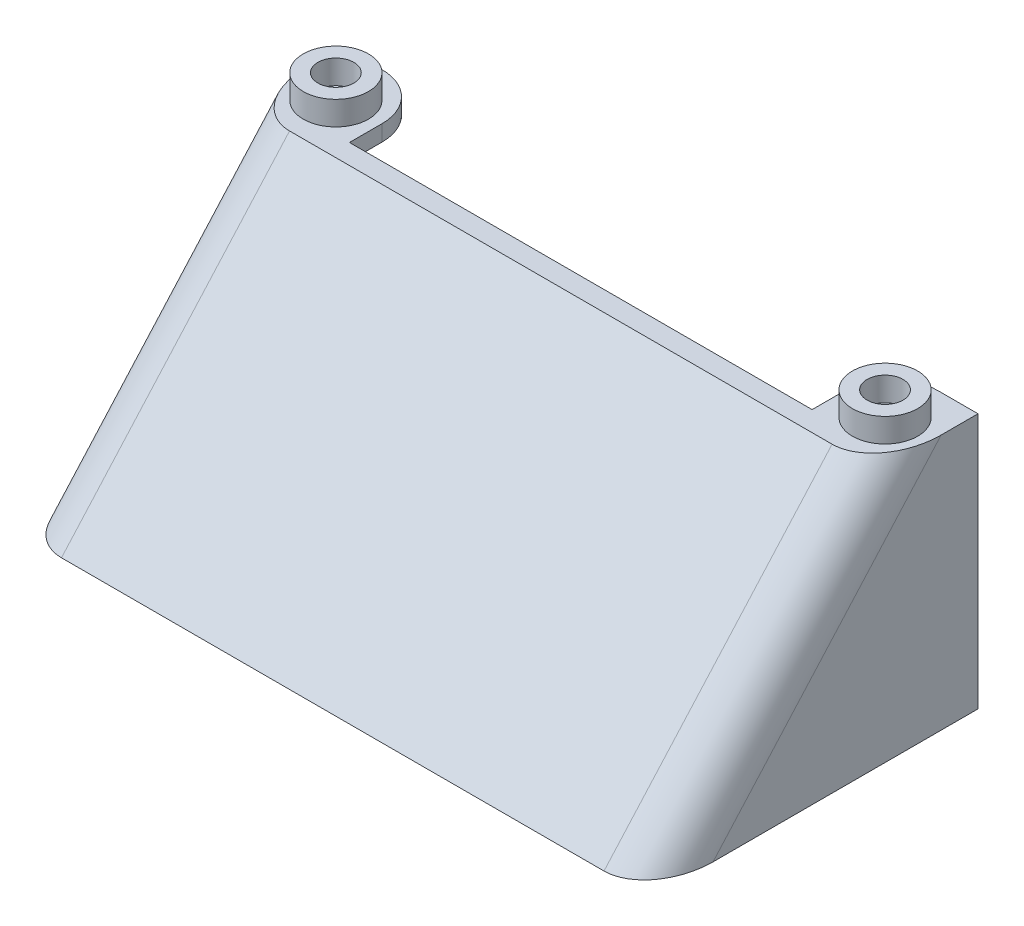
from build123d import *

# Parameters (mm, degrees)
BOSS_EXTRUDE1_DEPTH     = 47.75
SHELL2_T                = -1.2
SKETCH2_W               = 45.35
SKETCH2_H               = 17.927015757
CUT_EXTRUDE1_DEPTH      = 57.531559043
CUT_EXTRUDE2_DEPTH      = 58.038533691
CUT_EXTRUDE2_DEPTH_BACK = 58.038533691
BOSS_EXTRUDE2_DEPTH     = 3.5
CUT_EXTRUDE3_DEPTH      = 58.038533691
SKETCH7_R               = 2.45
SKETCH7_R_2             = 1.35
BOSS_EXTRUDE3_DEPTH     = 1.8
SHELL3_START            = -46.25
SHELL3_DEPTH            = 44.75
SHELL3_2_OUTLINE_W      = 2
SHELL3_2_OUTLINE_H      = 16.790482419
SHELL3_2_DEPTH          = 4.8
SHELL3_START_2          = -6.3
SHELL3_3_OUTLINE_W      = 2
SHELL3_3_OUTLINE_H      = 16.790482419
SHELL3_3_DEPTH          = 4.8
SKETCH8_R               = 1.5
SKETCH8_R_2             = 0.7
BOSS_EXTRUDE4_DEPTH     = 1.8
FILLET1_R               = 3.5


# Read off the part's stored shape, not the designer's step: Shell3
with BuildPart() as part:
    # Sketch1 → Boss-Extrude1 (new body)
    with BuildSketch(Plane(origin=(0, 0, 0), x_dir=(0, 0, -1), z_dir=(1, 0, 0))):
        Polygon((0, 0), (0, 19.2), (-7.46, 19.2), (-24.590482419, 0), align=None)
    extrude(amount=-BOSS_EXTRUDE1_DEPTH)

    # Shell2
    shell2_openings = [part.faces().sort_by_distance(p)[0] for p in [
        (-23.875, 0, 12.29524121),
    ]]
    offset(amount=SHELL2_T, openings=shell2_openings, kind=Kind.INTERSECTION)

    # Sketch2 → Cut-Extrude1 (cut, through all)
    with BuildSketch(Plane.XY.offset(1.2)):
        with Locations((-23.875, 8.963507878)):
            Rectangle(SKETCH2_W, SKETCH2_H)
    extrude(amount=-CUT_EXTRUDE1_DEPTH, mode=Mode.SUBTRACT)

    # Sketch3 → Cut-Extrude2 (cut, two sides: drawn at the far end of the back side and taken through both)
    with BuildSketch(Plane(origin=(0, 19.2, 0), x_dir=(1, 0, 0), z_dir=(0, 1, 0)).offset(-CUT_EXTRUDE2_DEPTH_BACK)):
        Polygon((-41.25, 106.046953634), (-41.25, 0), (-41.25, -5.96), (-6.5, -5.96), (-6.5, 0), (-6.5, 106.046953634), (-6.5, 318.140860903), (-41.25, 318.140860903), align=None)
    extrude(amount=CUT_EXTRUDE2_DEPTH + CUT_EXTRUDE2_DEPTH_BACK, mode=Mode.SUBTRACT)

    # Sketch5 → Boss-Extrude2 (add)
    with BuildSketch(Plane.XZ):
        Polygon((-47.75, 0), (-39.95, 0), (-39.95, 16.790482419), (-7.8, 16.790482419), (-7.8, 0), (0, 0), (0, 24.590482419), (-47.75, 24.590482419), align=None)
    extrude(amount=-BOSS_EXTRUDE2_DEPTH)

    # Sketch6 → Cut-Extrude3 (cut, through all)
    with BuildSketch(Plane.ZY.offset(47.75)):
        Polygon((21.467738228, 3.5), (24.590482419, 0), (24.590482419, 3.5), align=None)
    extrude(amount=-CUT_EXTRUDE3_DEPTH, mode=Mode.SUBTRACT)

    # Sketch7 → Boss-Extrude3 (add)
    # profile 1 of 2: a face of its own
    with BuildSketch(Plane(origin=(0, 19.2, 0), x_dir=(1, 0, 0), z_dir=(0, 1, 0))):
        with Locations(Location((-44.5, -3.73, 0), (0, 0, 270))):
            Circle(SKETCH7_R)
        with Locations(Location((-44.5, -3.73, 0), (0, 0, 270))):
            Circle(SKETCH7_R_2, mode=Mode.SUBTRACT)
    # profile 2 of 2: a face of its own
    with BuildSketch(Plane(origin=(0, 19.2, 0), x_dir=(1, 0, 0), z_dir=(0, 1, 0))):
        with Locations(Location((-3.25, -3.73, 0), (0, 0, 270))):
            Circle(SKETCH7_R)
        with Locations(Location((-3.25, -3.73, 0), (0, 0, 270))):
            Circle(SKETCH7_R_2, mode=Mode.SUBTRACT)
    extrude(amount=BOSS_EXTRUDE3_DEPTH)

    # Shell3 outline → Shell3 (cut)
    with BuildSketch(Plane.YZ.offset(SHELL3_START)):
        Polygon((2, 18.290482419), (2, 20.795809028), (0, 22.58023428), (0, 18.290482419), align=None)
    extrude(amount=SHELL3_DEPTH, mode=Mode.SUBTRACT)

    # Shell3 2 outline → Shell3 2 (cut)
    with BuildSketch(Plane.YZ.offset(SHELL3_START)):
        with Locations((1, 9.895241209)):
            Rectangle(SHELL3_2_OUTLINE_W, SHELL3_2_OUTLINE_H)
    extrude(amount=SHELL3_2_DEPTH, mode=Mode.SUBTRACT)

    # Shell3 3 outline → Shell3 3 (cut)
    with BuildSketch(Plane.YZ.offset(SHELL3_START_2)):
        with Locations((1, 9.895241209)):
            Rectangle(SHELL3_3_OUTLINE_W, SHELL3_3_OUTLINE_H)
    extrude(amount=SHELL3_3_DEPTH, mode=Mode.SUBTRACT)

    # Sketch8 → Boss-Extrude4 (add)
    # profile 1 of 4: a face of its own
    with BuildSketch(Plane.XZ.offset(-2)):
        with Locations(Location((-43.85, 8.196666667, 0), (0, 0, 270))):
            Circle(SKETCH8_R)
        with Locations(Location((-43.85, 8.196666667, 0), (0, 0, 270))):
            Circle(SKETCH8_R_2, mode=Mode.SUBTRACT)
    # profile 2 of 4: a face of its own
    with BuildSketch(Plane.XZ.offset(-2)):
        with Locations(Location((-43.85, 16.393333333, 0), (0, 0, 270))):
            Circle(SKETCH8_R)
        with Locations(Location((-43.85, 16.393333333, 0), (0, 0, 270))):
            Circle(SKETCH8_R_2, mode=Mode.SUBTRACT)
    # profile 3 of 4: a face of its own
    with BuildSketch(Plane.XZ.offset(-2)):
        with Locations(Location((-3.9, 16.393333333, 0), (0, 0, 90))):
            Circle(SKETCH8_R)
        with Locations(Location((-3.9, 16.393333333, 0), (0, 0, 270))):
            Circle(SKETCH8_R_2, mode=Mode.SUBTRACT)
    # profile 4 of 4: a face of its own
    with BuildSketch(Plane.XZ.offset(-2)):
        with Locations(Location((-3.9, 8.196666667, 0), (0, 0, 90))):
            Circle(SKETCH8_R)
        with Locations(Location((-3.9, 8.196666667, 0), (0, 0, 270))):
            Circle(SKETCH8_R_2, mode=Mode.SUBTRACT)
    extrude(amount=BOSS_EXTRUDE4_DEPTH)

    # Fillet1
    fillet1_edges = [part.edges().sort_by_distance(p)[0] for p in [
        (-47.75, 9.6, 16.02524121),
        (0, 9.6, 16.02524121),
        (-41.25, 18.563507879, 0),
        (-6.5, 18.563507879, 0),
    ]]
    fillet(fillet1_edges, radius=FILLET1_R)


solid = part.part
